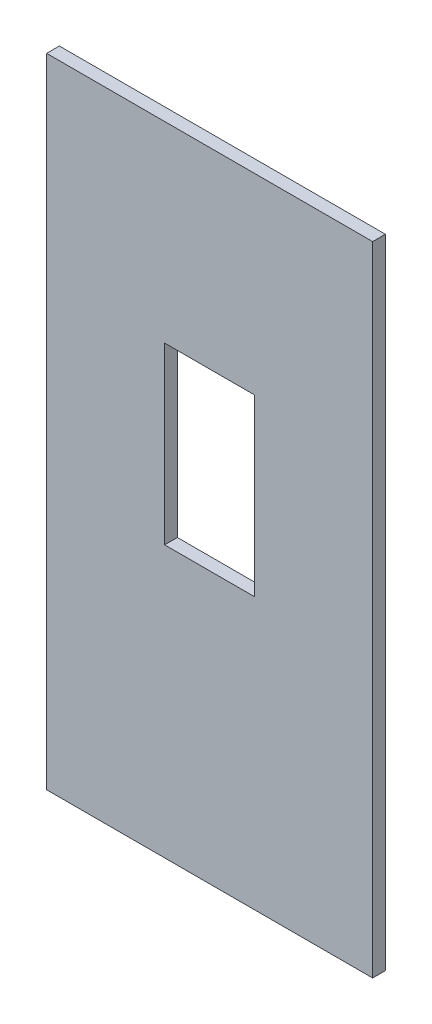
from build123d import *

# Parameters (mm, degrees)
SKETCH1_W           = 81.28
SKETCH1_H           = 159.004
BOSS_EXTRUDE1_DEPTH = 3.175
CUT_EXTRUDE1_REACH  = 91.343
SKETCH3_W           = 22.452421348
SKETCH3_H           = 43.56439963


with BuildPart() as part:
    # Sketch1 → Boss-Extrude1 (new body)
    with BuildSketch(Plane.XY):
        Rectangle(SKETCH1_W, SKETCH1_H)
    extrude(amount=BOSS_EXTRUDE1_DEPTH)

    # Sketch3 → Cut-Extrude1 (cut, up to next)
    with BuildSketch(Plane.XY.offset(3.175), mode=Mode.PRIVATE) as cut_extrude1_sk1:
        with Locations((0, 9.876031852)):
            Rectangle(SKETCH3_W, SKETCH3_H)
    cut_extrude1_tool1 = extrude(cut_extrude1_sk1.sketch, amount=-CUT_EXTRUDE1_REACH, mode=Mode.PRIVATE) & part.part
    add(cut_extrude1_tool1.solids().sort_by_distance((0, 9.876032, 3.175))[0], mode=Mode.SUBTRACT)


solid = part.part
